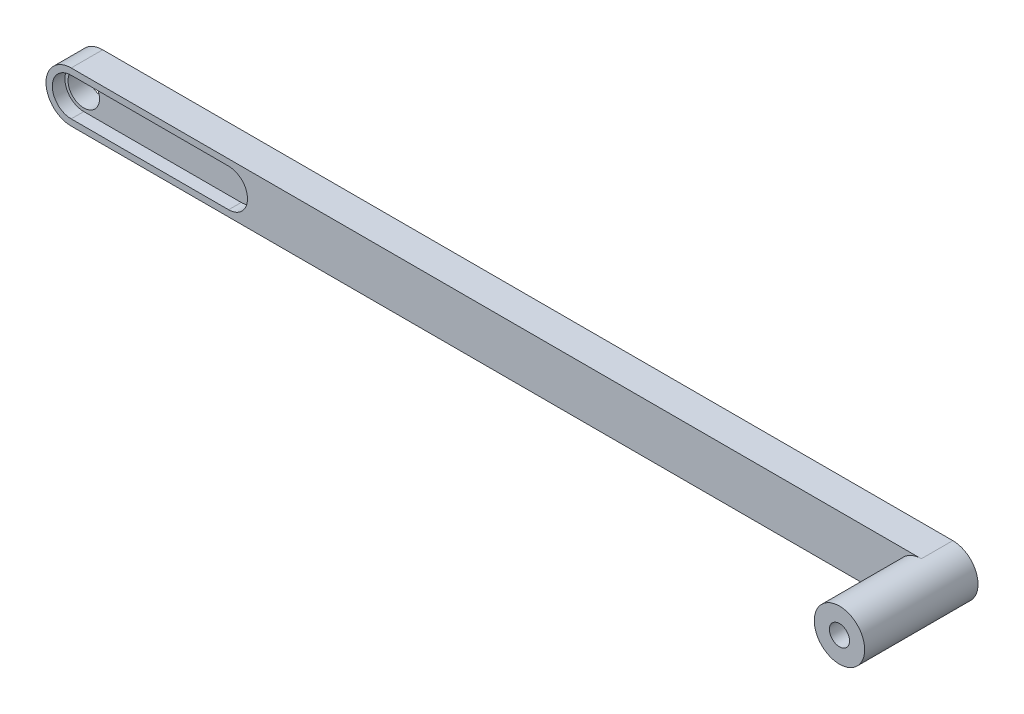
from build123d import *
from build123d.topology import SkipClean

# Parameters (mm, degrees)
SKETCH2_R           = 2.5
SKETCH2_R_2         = 1.6
BOSS_EXTRUDE1_DEPTH = 5
SKETCH3_R           = 1.6
BOSS_EXTRUDE2_DEPTH = 13
CUT_EXTRUDE1_DEPTH  = 2


with BuildPart() as part:
    # Sketch2 → Boss-Extrude1 (new body)
    with BuildSketch(Plane.XY):
        with BuildLine():
            Line((0, 4), (135, 4))
            ThreePointArc((135, 4), (139, 0), (135, -4))
            Line((135, -4), (0, -4))
            ThreePointArc((0, -4), (-4, 0), (0, 4))
        make_face()
        Circle(SKETCH2_R, mode=Mode.SUBTRACT)
        with Locations((135, 0)):
            Circle(SKETCH2_R_2, mode=Mode.SUBTRACT)
    extrude(amount=BOSS_EXTRUDE1_DEPTH)

    # Sketch3 → Boss-Extrude2 (add)
    with SkipClean():  # the faces are left unmerged after this step: merging them gives an invalid solid
        with BuildSketch(Plane.XY.offset(5)):
            with BuildLine():
                ThreePointArc((135, 4), (131, 0), (135, -4))
                ThreePointArc((135, -4), (139, 0), (135, 4))
            make_face()
            with Locations((135, 0)):
                Circle(SKETCH3_R, mode=Mode.SUBTRACT)
        extrude(amount=BOSS_EXTRUDE2_DEPTH)
    add(part.part.scale(1), mode=Mode.REPLACE)  # the faces are merged on a copy

    # Sketch4 → Cut-Extrude1 (cut)
    with BuildSketch(Plane.XY.offset(5)):
        with BuildLine():
            Line((0, 3), (25, 3))
            ThreePointArc((25, 3), (28, 0), (25, -3))
            Line((25, -3), (0, -3))
            ThreePointArc((0, -3), (-3, 0), (0, 3))
        make_face()
    extrude(amount=-CUT_EXTRUDE1_DEPTH, mode=Mode.SUBTRACT)


solid = part.part
